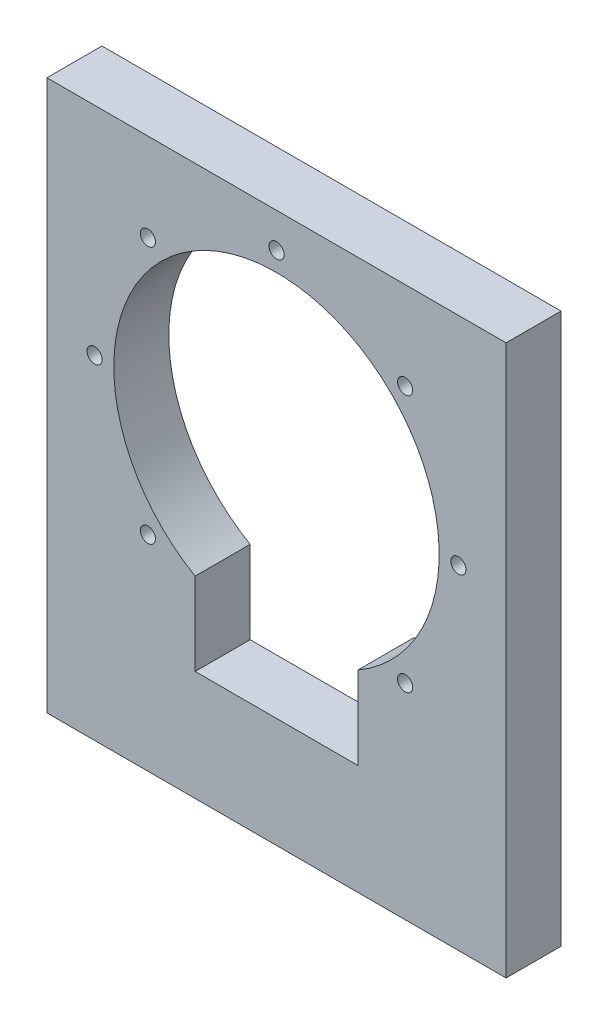
from build123d import *

# Parameters (mm, degrees)
SKETCH1_W           = 106
SKETCH1_H           = 127
SKETCH1_R           = 1.746
BOSS_EXTRUDE1_DEPTH = 12.7


with BuildPart() as part:
    # Sketch1 → Boss-Extrude1 (new body)
    with BuildSketch(Plane.XY):
        with Locations((53, 12.7)):
            Rectangle(SKETCH1_W, SKETCH1_H)
        with Locations((82.698486542, 55.898482492)):
            Circle(SKETCH1_R, mode=Mode.SUBTRACT)
        with Locations((95.00000245, 26.19999595)):
            Circle(SKETCH1_R, mode=Mode.SUBTRACT)
        with Locations((82.698486542, -3.498490592)):
            Circle(SKETCH1_R, mode=Mode.SUBTRACT)
        with Locations((23.301513458, -3.498490592)):
            Circle(SKETCH1_R, mode=Mode.SUBTRACT)
        with Locations((10.99999755, 26.1999984)):
            Circle(SKETCH1_R, mode=Mode.SUBTRACT)
        with Locations((23.301513458, 55.898482492)):
            Circle(SKETCH1_R, mode=Mode.SUBTRACT)
        with Locations((53, 68.1999984)):
            Circle(SKETCH1_R, mode=Mode.SUBTRACT)
        with BuildLine():
            Line((34.21825, -6.330946855), (34.21825, -25.4))
            Line((34.21825, -25.4), (71.78175, -25.4))
            Line((71.78175, -25.4), (71.78175, -6.330946855))
            ThreePointArc((71.78175, -6.330946855), (53, 63.7634984), (34.21825, -6.330946855))
        make_face(mode=Mode.SUBTRACT)
    extrude(amount=BOSS_EXTRUDE1_DEPTH)


solid = part.part
